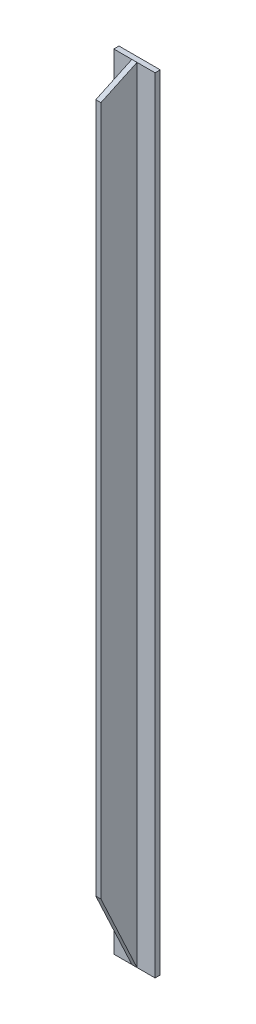
from build123d import *

# Parameters (mm, degrees)
BOSS_EXTRUDE1_DEPTH = 482.6
CUT_EXTRUDE1_DEPTH  = 438.15


with BuildPart() as part:
    # Sketch2 → Boss-Extrude1 (new body)
    with BuildSketch(Plane(origin=(0, 0, 0), x_dir=(1, 0, 0), z_dir=(0, 1, 0))):
        Polygon((0, 0), (3.175, 0), (3.175, 22.225), (14.2875, 22.225), (14.2875, 25.4), (-11.1125, 25.4), (-11.1125, 22.225), (0, 22.225), align=None)
    extrude(amount=BOSS_EXTRUDE1_DEPTH)

    # Sketch4 → Cut-Extrude1 (cut)
    with BuildSketch(Plane(origin=(3.175, 0, 0), x_dir=(0, 0, -1), z_dir=(1, 0, 0))):
        Polygon((22.225, 0), (0, 47.661666308), (0, 0), align=None)
        Polygon((22.225, 482.6), (0, 472.236312298), (0, 482.6), align=None)
    extrude(amount=-CUT_EXTRUDE1_DEPTH, mode=Mode.SUBTRACT)


solid = part.part
